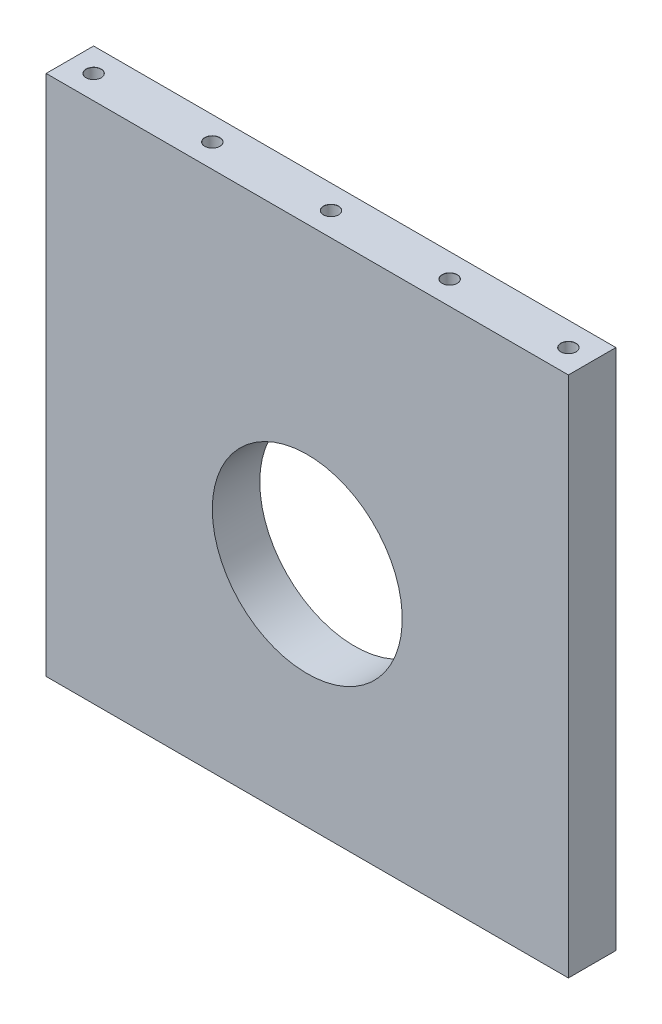
from build123d import *

# Parameters (mm, degrees)
SKETCH1_W                              = 110
SKETCH1_H                              = 110
BOSS_EXTRUDE1_DEPTH                    = 10
TAP_DRILL_FOR_M3_HELICOIL1_D           = 3.15
TAP_DRILL_FOR_M3_HELICOIL1_DEPTH       = 6
TAP_DRILL_FOR_M3_HELICOIL1_CSINK_D     = 3.2
TAP_DRILL_FOR_M3_HELICOIL1_CSINK_ANGLE = 90
TAP_DRILL_FOR_M3_HELICOIL1_TIP         = 0.946355475
F_40_0_40_DIAMETER_HOLE1_D             = 40


with BuildPart() as part:
    # Sketch1 → Boss-Extrude1 (new body)
    with BuildSketch(Plane.XY):
        with Locations((55, 55)):
            Rectangle(SKETCH1_W, SKETCH1_H)
    extrude(amount=BOSS_EXTRUDE1_DEPTH)

    # Tap Drill for M3 Helicoil1
    with Locations(Plane(origin=(0, 110, 0), x_dir=(1, 0, 0), z_dir=(0, 1, 0))):
        with Locations((5, -5), (55, -5), (80, -5), (105, -5), (30, -5)):
            CounterSinkHole(TAP_DRILL_FOR_M3_HELICOIL1_D / 2, TAP_DRILL_FOR_M3_HELICOIL1_CSINK_D / 2, depth=TAP_DRILL_FOR_M3_HELICOIL1_DEPTH, counter_sink_angle=TAP_DRILL_FOR_M3_HELICOIL1_CSINK_ANGLE)
            with Locations((0, 0, -(TAP_DRILL_FOR_M3_HELICOIL1_DEPTH + TAP_DRILL_FOR_M3_HELICOIL1_TIP / 2))):  # 118° drill point
                Cone(0, TAP_DRILL_FOR_M3_HELICOIL1_D / 2, TAP_DRILL_FOR_M3_HELICOIL1_TIP, mode=Mode.SUBTRACT)

    # Ø40.0 (40) Diameter Hole1 (through all)
    with Locations(Plane(origin=(0, 0, 0), x_dir=(-1, 0, 0), z_dir=(0, 0, -1))):
        with Locations((-55, 48)):
            Hole(F_40_0_40_DIAMETER_HOLE1_D / 2)


solid = part.part
